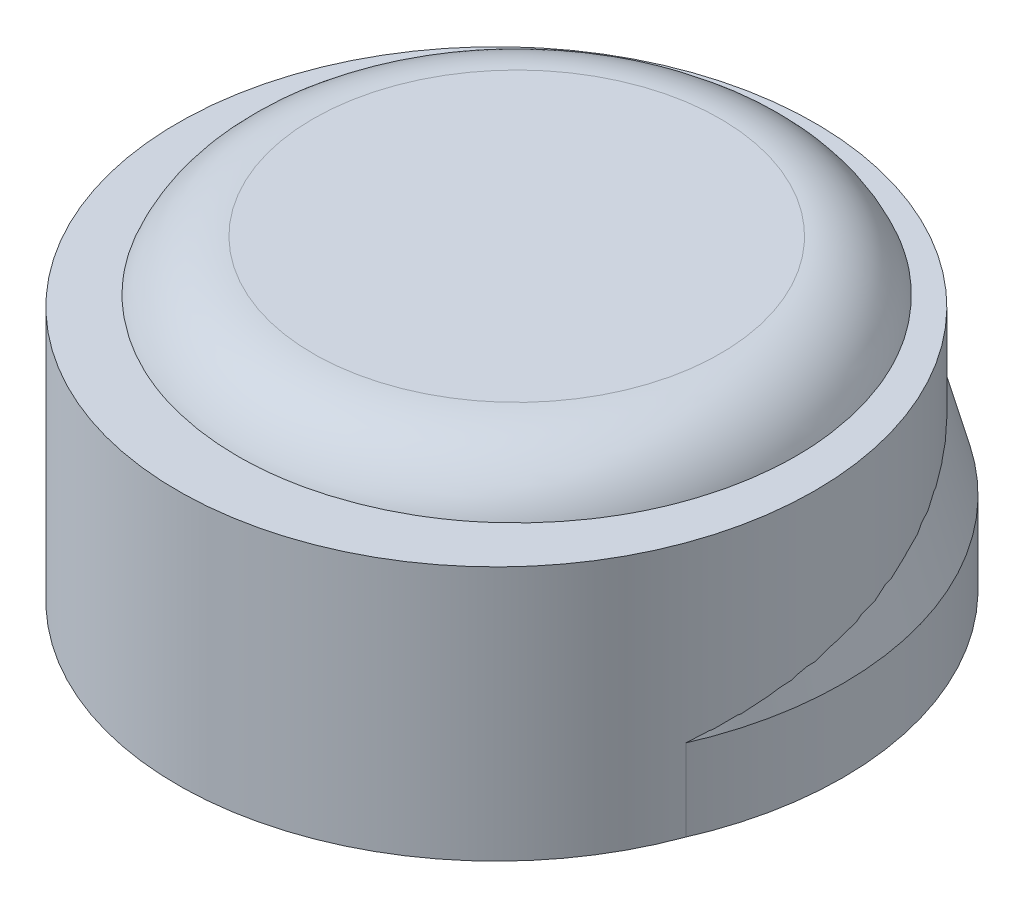
from build123d import *

# Parameters (mm, degrees)
DELETEFACE1_OUTLINE_R = 1.4732
DELETEFACE1_DEPTH     = 7.62
SKETCH3_R             = 3.873
BOSS_EXTRUDE1_DEPTH   = 1.778
SKETCH4_R             = 7.9375
BOSS_EXTRUDE2_DEPTH   = 6.35


# Read off the part's stored shape, not the designer's step: DeleteFace1
with BuildPart() as part:
    # Sketch1 → Revolve1 (revolve)
    with BuildSketch(Plane.XY):
        with BuildLine():
            Line((-1.4732, 0), (-8.128, 0))
            Line((-8.128, 0), (-8.128, 2.032))
            Line((-8.128, 2.032), (-7.034252752, 6.1139203))
            ThreePointArc((-7.034252752, 6.1139203), (-6.308494697, 7.200093987), (-5.071491473, 7.62))
            Line((-5.071491473, 7.62), (-1.4732, 7.62))
            Line((-1.4732, 7.62), (-1.4732, 0))
        make_face()
    revolve(axis=Axis((0, 0, 0), (0, -1, 0)))

    # DeleteFace1 outline → DeleteFace1 (add)
    with BuildSketch(Plane(origin=(0, 0, 0), x_dir=(1, 0, 0), z_dir=(0, 1, 0))):
        Circle(DELETEFACE1_OUTLINE_R)
    extrude(amount=DELETEFACE1_DEPTH)

    # Sketch3 → Boss-Extrude1 (add)
    with BuildSketch(Plane.XZ):
        with Locations((0, 2)):
            Circle(SKETCH3_R)
    extrude(amount=BOSS_EXTRUDE1_DEPTH)


with BuildPart() as body_2:
    # Sketch4 → Boss-Extrude2 (new body)
    with BuildSketch(Plane.XZ):
        with Locations((0, 0.508)):
            Circle(SKETCH4_R)
    extrude(amount=-BOSS_EXTRUDE2_DEPTH)


solid = Compound([part.part, body_2.part])
